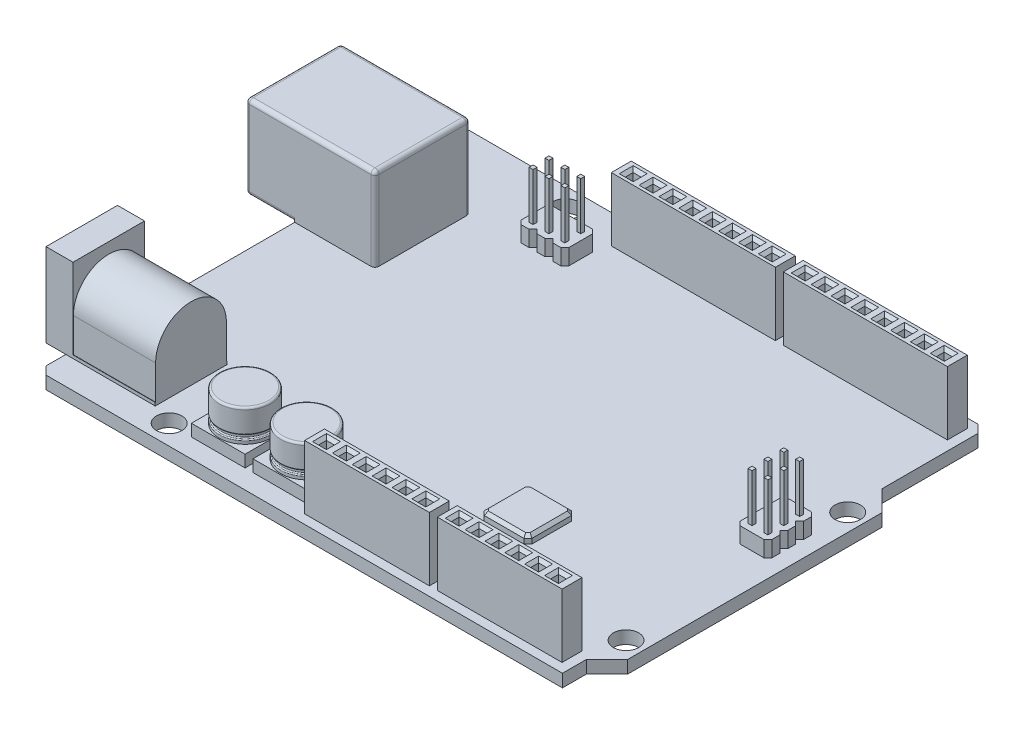
from build123d import *

# Parameters (mm, degrees)
SKETCH1_R           = 1.6
BOSS_EXTRUDE1_DEPTH = 1.6
SKETCH2_W           = 16.3
SKETCH2_H           = 12
SKETCH2_W_2         = 13.75
SKETCH2_H_2         = 9
BOSS_EXTRUDE2_DEPTH = 10.5
SKETCH4_W           = 5.376043544
SKETCH4_H           = 2.5
CUT_EXTRUDE1_DEPTH  = 10
FILLET1_R           = 0.5
SKETCH5_R           = 3.5
SKETCH5_R_2         = 0.5
CUT_EXTRUDE2_DEPTH  = 10
CUT_EXTRUDE3_DEPTH  = 10.35
FILLET2_R           = 0.5
SKETCH7_W           = 20.65
SKETCH7_H           = 2.5
SKETCH7_W_2         = 1
SKETCH7_H_2         = 1
SKETCH7_W_3         = 15.7
BOSS_EXTRUDE3_DEPTH = 8
CHAMFER1_SIZE       = 0.375
SKETCH8_W           = 6.75
SKETCH8_H           = 6.75
BOSS_EXTRUDE4_DEPTH = 1.5
SKETCH9_R           = 3.25
BOSS_EXTRUDE5_DEPTH = 4
FILLET3_R           = 0.25
CUT_EXTRUDE4_START  = -0.5
SKETCH10_R          = 3.25
SKETCH10_R_2        = 3
CUT_EXTRUDE4_DEPTH  = 0.5
FILLET4_R           = 0.125
BOSS_EXTRUDE7_DEPTH = 2
SKETCH12_W          = 0.5
SKETCH12_H          = 0.5
BOSS_EXTRUDE8_DEPTH = 6
BOSS_EXTRUDE9_DEPTH = 1
CHAMFER2_SIZE       = 0.375


with BuildPart() as part:
    # Sketch1 → Boss-Extrude1 (new body)
    with BuildSketch(Plane(origin=(0, 0, 0), x_dir=(1, 0, 0), z_dir=(0, 1, 0))):
        Polygon((35.6, 10.95), (35.6, -21.05), (33, -23.65), (33, -26.65), (-32, -26.65), (-33, -25.65), (-33, 25.65), (-32, 26.65), (32, 26.65), (33, 25.65), (33, 13.55), align=None)
        with Locations(Location((-17.4, 24.15, 0), (0, 0, 270))):
            Circle(SKETCH1_R, mode=Mode.SUBTRACT)
        with Locations(Location((-19, -24.15, 0), (0, 0, 270))):
            Circle(SKETCH1_R, mode=Mode.SUBTRACT)
        with Locations(Location((33.4, -19.05, 0), (0, 0, 270))):
            Circle(SKETCH1_R, mode=Mode.SUBTRACT)
        with Locations(Location((33.4, 8.85, 0), (0, 0, 270))):
            Circle(SKETCH1_R, mode=Mode.SUBTRACT)
    extrude(amount=BOSS_EXTRUDE1_DEPTH)

    # Sketch2 → Boss-Extrude2 (add)
    with BuildSketch(Plane(origin=(0, 1.6, 0), x_dir=(1, 0, 0), z_dir=(0, 1, 0))):
        with Locations((-31.05, 11.65)):
            Rectangle(SKETCH2_W, SKETCH2_H)
        with Locations((-28.625, -18.65)):
            Rectangle(SKETCH2_W_2, SKETCH2_H_2)
    extrude(amount=BOSS_EXTRUDE2_DEPTH)

    # Sketch4 → Cut-Extrude1 (cut)
    with BuildSketch(Plane.ZY.offset(39.2)):
        Polygon((-7.15, 3.1), (-16.15, 3.1), (-16.15, 8.105420966), (-14.338021772, 10.6), (-8.961978228, 10.6), (-7.15, 8.105420966), align=None)
        with Locations((-11.65, 6.855420966)):
            Rectangle(SKETCH4_W, SKETCH4_H, mode=Mode.SUBTRACT)
    extrude(amount=-CUT_EXTRUDE1_DEPTH, mode=Mode.SUBTRACT)

    # Fillet1
    fillet1_edges = [part.edges().sort_by_distance(p)[0] for p in [
        (-39.2, 12.1, -11.65),
        (-39.2, 1.6, -11.65),
        (-36.1, 1.6, -17.65),
        (-36.1, 1.6, -5.65),
        (-39.2, 6.85, -17.65),
        (-39.2, 6.85, -5.65),
        (-22.9, 6.85, -17.65),
        (-22.9, 6.85, -5.65),
        (-22.9, 12.1, -11.65),
        (-31.05, 12.1, -17.65),
        (-31.05, 12.1, -5.65),
    ]]
    fillet(fillet1_edges, radius=FILLET1_R)

    # Sketch5 → Cut-Extrude2 (cut)
    with BuildSketch(Plane.ZY.offset(35.5)):
        with Locations((18.65, 6.85)):
            Circle(SKETCH5_R)
        with Locations((18.65, 6.85)):
            Circle(SKETCH5_R_2, mode=Mode.SUBTRACT)
    extrude(amount=-CUT_EXTRUDE2_DEPTH, mode=Mode.SUBTRACT)

    # Sketch6 → Cut-Extrude3 (cut)
    with BuildSketch(Plane(origin=(-21.75, 0, 0), x_dir=(0, 0, -1), z_dir=(1, 0, 0))):
        with BuildLine():
            Line((-23.105926405, 6.272920857), (-23.105926405, 1.999528991))
            Line((-23.105926405, 1.999528991), (-23.15, 1.999528991))
            Line((-23.15, 1.999528991), (-23.15, 12.1))
            Line((-23.15, 12.1), (-14.15, 12.1))
            Line((-14.15, 12.1), (-14.15, 1.999528991))
            Line((-14.15, 1.999528991), (-14.194073595, 1.999528991))
            Line((-14.194073595, 1.999528991), (-14.194073595, 6.272920857))
            ThreePointArc((-14.194073595, 6.272920857), (-18.65, 10.728847263), (-23.105926405, 6.272920857))
        make_face()
    extrude(amount=-CUT_EXTRUDE3_DEPTH, mode=Mode.SUBTRACT)

    # Fillet2
    fillet2_edges = [part.edges().sort_by_distance(p)[0] for p in [
        (-35.5, 6.85, 18.15),
    ]]
    fillet(fillet2_edges, radius=FILLET2_R)

    # Sketch7 → Boss-Extrude3 (add)
    # profile 1 of 4: a face of its own
    with BuildSketch(Plane(origin=(0, 1.6, 0), x_dir=(1, 0, 0), z_dir=(0, 1, 0))):
        with Locations((-0.175152298, 24.25)):
            Rectangle(SKETCH7_W, SKETCH7_H)
        with Locations((-9.000152298, 24.25)):
            Rectangle(SKETCH7_W_2, SKETCH7_H_2, mode=Mode.SUBTRACT)
        with Locations((-6.500152298, 24.25)):
            Rectangle(SKETCH7_W_2, SKETCH7_H_2, mode=Mode.SUBTRACT)
        with Locations((-4.000152298, 24.25)):
            Rectangle(SKETCH7_W_2, SKETCH7_H_2, mode=Mode.SUBTRACT)
        with Locations((-1.500152298, 24.25)):
            Rectangle(SKETCH7_W_2, SKETCH7_H_2, mode=Mode.SUBTRACT)
        with Locations((0.999847702, 24.25)):
            Rectangle(SKETCH7_W_2, SKETCH7_H_2, mode=Mode.SUBTRACT)
        with Locations((3.499847702, 24.25)):
            Rectangle(SKETCH7_W_2, SKETCH7_H_2, mode=Mode.SUBTRACT)
        with Locations((5.999847702, 24.25)):
            Rectangle(SKETCH7_W_2, SKETCH7_H_2, mode=Mode.SUBTRACT)
        with Locations((8.499847702, 24.25)):
            Rectangle(SKETCH7_W_2, SKETCH7_H_2, mode=Mode.SUBTRACT)
    # profile 2 of 4: a face of its own
    with BuildSketch(Plane(origin=(0, 1.6, 0), x_dir=(1, 0, 0), z_dir=(0, 1, 0))):
        with Locations((21.474847702, 24.25)):
            Rectangle(SKETCH7_W, SKETCH7_H)
        with Locations((12.649847702, 24.25)):
            Rectangle(SKETCH7_W_2, SKETCH7_H_2, mode=Mode.SUBTRACT)
        with Locations((15.149847702, 24.25)):
            Rectangle(SKETCH7_W_2, SKETCH7_H_2, mode=Mode.SUBTRACT)
        with Locations((17.649847702, 24.25)):
            Rectangle(SKETCH7_W_2, SKETCH7_H_2, mode=Mode.SUBTRACT)
        with Locations((20.149847702, 24.25)):
            Rectangle(SKETCH7_W_2, SKETCH7_H_2, mode=Mode.SUBTRACT)
        with Locations((22.649847702, 24.25)):
            Rectangle(SKETCH7_W_2, SKETCH7_H_2, mode=Mode.SUBTRACT)
        with Locations((25.149847702, 24.25)):
            Rectangle(SKETCH7_W_2, SKETCH7_H_2, mode=Mode.SUBTRACT)
        with Locations((27.649847702, 24.25)):
            Rectangle(SKETCH7_W_2, SKETCH7_H_2, mode=Mode.SUBTRACT)
        with Locations((30.149847702, 24.25)):
            Rectangle(SKETCH7_W_2, SKETCH7_H_2, mode=Mode.SUBTRACT)
    # profile 3 of 4: a face of its own
    with BuildSketch(Plane(origin=(0, 1.6, 0), x_dir=(1, 0, 0), z_dir=(0, 1, 0))):
        with Locations((23.949847702, -24.25)):
            Rectangle(SKETCH7_W_3, SKETCH7_H)
        with Locations((17.599847702, -24.25)):
            Rectangle(SKETCH7_W_2, SKETCH7_H_2, mode=Mode.SUBTRACT)
        with Locations((20.099847702, -24.25)):
            Rectangle(SKETCH7_W_2, SKETCH7_H_2, mode=Mode.SUBTRACT)
        with Locations((22.599847702, -24.25)):
            Rectangle(SKETCH7_W_2, SKETCH7_H_2, mode=Mode.SUBTRACT)
        with Locations((25.099847702, -24.25)):
            Rectangle(SKETCH7_W_2, SKETCH7_H_2, mode=Mode.SUBTRACT)
        with Locations((27.599847702, -24.25)):
            Rectangle(SKETCH7_W_2, SKETCH7_H_2, mode=Mode.SUBTRACT)
        with Locations((30.099847702, -24.25)):
            Rectangle(SKETCH7_W_2, SKETCH7_H_2, mode=Mode.SUBTRACT)
    # profile 4 of 4: a face of its own
    with BuildSketch(Plane(origin=(0, 1.6, 0), x_dir=(1, 0, 0), z_dir=(0, 1, 0))):
        with Locations((7.249847702, -24.25)):
            Rectangle(SKETCH7_W_3, SKETCH7_H)
        with Locations((3.399847702, -24.25)):
            Rectangle(SKETCH7_W_2, SKETCH7_H_2, mode=Mode.SUBTRACT)
        with Locations((0.899847702, -24.25)):
            Rectangle(SKETCH7_W_2, SKETCH7_H_2, mode=Mode.SUBTRACT)
        with Locations((5.899847702, -24.25)):
            Rectangle(SKETCH7_W_2, SKETCH7_H_2, mode=Mode.SUBTRACT)
        with Locations((8.399847702, -24.25)):
            Rectangle(SKETCH7_W_2, SKETCH7_H_2, mode=Mode.SUBTRACT)
        with Locations((10.899847702, -24.25)):
            Rectangle(SKETCH7_W_2, SKETCH7_H_2, mode=Mode.SUBTRACT)
        with Locations((13.399847702, -24.25)):
            Rectangle(SKETCH7_W_2, SKETCH7_H_2, mode=Mode.SUBTRACT)
    extrude(amount=BOSS_EXTRUDE3_DEPTH)

    # Chamfer1
    chamfer1_edges = [part.edges().sort_by_distance(p)[0] for p in [
        (-9.500152298, 9.6, -24.25),
        (-9.000152298, 9.6, -23.75),
        (-8.500152298, 9.6, -24.25),
        (-9.000152298, 9.6, -24.75),
        (-7.000152298, 9.6, -24.25),
        (-6.500152298, 9.6, -23.75),
        (-6.000152298, 9.6, -24.25),
        (-6.500152298, 9.6, -24.75),
        (-4.500152298, 9.6, -24.25),
        (-4.000152298, 9.6, -23.75),
        (-3.500152298, 9.6, -24.25),
        (-4.000152298, 9.6, -24.75),
        (-2.000152298, 9.6, -24.25),
        (-1.500152298, 9.6, -23.75),
        (-1.000152298, 9.6, -24.25),
        (-1.500152298, 9.6, -24.75),
        (0.499847702, 9.6, -24.25),
        (0.999847702, 9.6, -23.75),
        (1.499847702, 9.6, -24.25),
        (0.999847702, 9.6, -24.75),
        (2.999847702, 9.6, -24.25),
        (3.499847702, 9.6, -23.75),
        (3.999847702, 9.6, -24.25),
        (3.499847702, 9.6, -24.75),
        (5.499847702, 9.6, -24.25),
        (5.999847702, 9.6, -23.75),
        (6.499847702, 9.6, -24.25),
        (5.999847702, 9.6, -24.75),
        (7.999847702, 9.6, -24.25),
        (8.499847702, 9.6, -23.75),
        (8.999847702, 9.6, -24.25),
        (8.499847702, 9.6, -24.75),
        (12.149847702, 9.6, -24.25),
        (12.649847702, 9.6, -23.75),
        (13.149847702, 9.6, -24.25),
        (12.649847702, 9.6, -24.75),
        (14.649847702, 9.6, -24.25),
        (15.149847702, 9.6, -23.75),
        (15.649847702, 9.6, -24.25),
        (15.149847702, 9.6, -24.75),
        (17.149847702, 9.6, -24.25),
        (17.649847702, 9.6, -23.75),
        (18.149847702, 9.6, -24.25),
        (17.649847702, 9.6, -24.75),
        (19.649847702, 9.6, -24.25),
        (20.149847702, 9.6, -23.75),
        (20.649847702, 9.6, -24.25),
        (20.149847702, 9.6, -24.75),
        (22.149847702, 9.6, -24.25),
        (22.649847702, 9.6, -23.75),
        (23.149847702, 9.6, -24.25),
        (22.649847702, 9.6, -24.75),
        (24.649847702, 9.6, -24.25),
        (25.149847702, 9.6, -23.75),
        (25.649847702, 9.6, -24.25),
        (25.149847702, 9.6, -24.75),
        (27.149847702, 9.6, -24.25),
        (27.649847702, 9.6, -23.75),
        (28.149847702, 9.6, -24.25),
        (27.649847702, 9.6, -24.75),
        (29.649847702, 9.6, -24.25),
        (30.149847702, 9.6, -23.75),
        (30.649847702, 9.6, -24.25),
        (30.149847702, 9.6, -24.75),
        (17.099847702, 9.6, 24.25),
        (17.599847702, 9.6, 24.75),
        (18.099847702, 9.6, 24.25),
        (17.599847702, 9.6, 23.75),
        (19.599847702, 9.6, 24.25),
        (20.099847702, 9.6, 24.75),
        (20.599847702, 9.6, 24.25),
        (20.099847702, 9.6, 23.75),
        (22.099847702, 9.6, 24.25),
        (22.599847702, 9.6, 24.75),
        (23.099847702, 9.6, 24.25),
        (22.599847702, 9.6, 23.75),
        (24.599847702, 9.6, 24.25),
        (25.099847702, 9.6, 24.75),
        (25.599847702, 9.6, 24.25),
        (25.099847702, 9.6, 23.75),
        (27.099847702, 9.6, 24.25),
        (27.599847702, 9.6, 24.75),
        (28.099847702, 9.6, 24.25),
        (27.599847702, 9.6, 23.75),
        (29.599847702, 9.6, 24.25),
        (30.099847702, 9.6, 24.75),
        (30.599847702, 9.6, 24.25),
        (30.099847702, 9.6, 23.75),
        (0.399847702, 9.6, 24.25),
        (0.899847702, 9.6, 24.75),
        (1.399847702, 9.6, 24.25),
        (0.899847702, 9.6, 23.75),
        (2.899847702, 9.6, 24.25),
        (3.399847702, 9.6, 24.75),
        (3.899847702, 9.6, 24.25),
        (3.399847702, 9.6, 23.75),
        (5.399847702, 9.6, 24.25),
        (5.899847702, 9.6, 24.75),
        (6.399847702, 9.6, 24.25),
        (5.899847702, 9.6, 23.75),
        (7.899847702, 9.6, 24.25),
        (8.399847702, 9.6, 24.75),
        (8.899847702, 9.6, 24.25),
        (8.399847702, 9.6, 23.75),
        (10.399847702, 9.6, 24.25),
        (10.899847702, 9.6, 24.75),
        (11.399847702, 9.6, 24.25),
        (10.899847702, 9.6, 23.75),
        (12.899847702, 9.6, 24.25),
        (13.399847702, 9.6, 24.75),
        (13.899847702, 9.6, 24.25),
        (13.399847702, 9.6, 23.75),
    ]]
    chamfer(chamfer1_edges, length=CHAMFER1_SIZE)

    # Sketch8 → Boss-Extrude4 (add)
    with BuildSketch(Plane(origin=(0, 1.6, 0), x_dir=(1, 0, 0), z_dir=(0, 1, 0))):
        with Locations((-4.975152298, -20.875)):
            Rectangle(SKETCH8_W, SKETCH8_H)
        with Locations((-12.725152298, -20.875)):
            Rectangle(SKETCH8_W, SKETCH8_H)
    extrude(amount=BOSS_EXTRUDE4_DEPTH)

    # Sketch9 → Boss-Extrude5 (add)
    with BuildSketch(Plane(origin=(0, 3.1, 0), x_dir=(1, 0, 0), z_dir=(0, 1, 0))):
        with Locations(Location((-4.975152298, -20.875, 0), (0, 0, 270))):
            Circle(SKETCH9_R)
        with Locations(Location((-12.725152298, -20.875, 0), (0, 0, 270))):
            Circle(SKETCH9_R)
    extrude(amount=BOSS_EXTRUDE5_DEPTH)

    # Fillet3
    fillet3_edges = [part.edges().sort_by_distance(p)[0] for p in [
        (-4.975152298, 7.1, 17.625),
        (-12.725152298, 7.1, 17.625),
    ]]
    fillet(fillet3_edges, radius=FILLET3_R)

    # Sketch10 → Cut-Extrude4 (cut)
    # profile 1 of 2: a face of its own
    with BuildSketch(Plane(origin=(0, 4.1, 0), x_dir=(-1, 0, 0), z_dir=(0, 1, 0)).offset(CUT_EXTRUDE4_START)):
        with Locations(Location((4.975152298, 20.875, 0), (0, 0, 90))):
            Circle(SKETCH10_R)
        with Locations(Location((4.975152298, 20.875, 0), (0, 0, 90))):
            Circle(SKETCH10_R_2, mode=Mode.SUBTRACT)
    # profile 2 of 2: a face of its own
    with BuildSketch(Plane(origin=(0, 4.1, 0), x_dir=(-1, 0, 0), z_dir=(0, 1, 0)).offset(CUT_EXTRUDE4_START)):
        with Locations(Location((12.725152298, 20.875, 0), (0, 0, 90))):
            Circle(SKETCH10_R)
        with Locations(Location((12.725152298, 20.875, 0), (0, 0, 90))):
            Circle(SKETCH10_R_2, mode=Mode.SUBTRACT)
    extrude(amount=CUT_EXTRUDE4_DEPTH, mode=Mode.SUBTRACT)

    # Fillet4
    fillet4_edges = [part.edges().sort_by_distance(p)[0] for p in [
        (-4.975152298, 3.6, 17.625),
        (-4.975152298, 3.6, 17.875),
        (-4.975152298, 4.1, 17.625),
        (-4.975152298, 4.1, 17.875),
        (-12.725152298, 3.6, 17.625),
        (-12.725152298, 3.6, 17.875),
        (-12.725152298, 4.1, 17.625),
        (-12.725152298, 4.1, 17.875),
    ]]
    fillet(fillet4_edges, radius=FILLET4_R - 0.0001)  # a hair under: the kernel refuses the full size

    # Sketch11 → Boss-Extrude7 (add)
    with BuildSketch(Plane(origin=(0, 1.6, 0), x_dir=(1, 0, 0), z_dir=(0, 1, 0))):
        Polygon((-16.5, 21.65), (-17, 21.15), (-17, 18.15), (-16.5, 17.65), (-15.5, 17.65), (-15, 18.15), (-14.5, 17.65), (-13.5, 17.65), (-13, 18.15), (-12.5, 17.65), (-11.5, 17.65), (-11, 18.15), (-11, 21.15), (-11.5, 21.65), (-12.5, 21.65), (-13, 21.15), (-13.5, 21.65), (-14.5, 21.65), (-15, 21.15), (-15.5, 21.65), align=None)
        Polygon((30.1, 4.606591107), (29.6, 4.106591107), (29.6, 3.106591107), (30.1, 2.606591107), (29.6, 2.106591107), (29.6, 1.106591107), (30.1, 0.606591107), (29.6, 0.106591107), (29.6, -0.893408893), (30.1, -1.393408893), (33.1, -1.393408893), (33.6, -0.893408893), (33.6, 0.106591107), (33.1, 0.606591107), (33.6, 1.106591107), (33.6, 2.106591107), (33.1, 2.606591107), (33.6, 3.106591107), (33.6, 4.106591107), (33.1, 4.606591107), align=None)
    extrude(amount=BOSS_EXTRUDE7_DEPTH)

    # Sketch12 → Boss-Extrude8 (add)
    with BuildSketch(Plane(origin=(0, 3.6, 0), x_dir=(1, 0, 0), z_dir=(0, 1, 0))):
        with Locations((-16, 20.65)):
            Rectangle(SKETCH12_W, SKETCH12_H)
        with Locations((-16, 18.65)):
            Rectangle(SKETCH12_W, SKETCH12_H)
        with Locations((-14, 20.65)):
            Rectangle(SKETCH12_W, SKETCH12_H)
        with Locations((-14, 18.65)):
            Rectangle(SKETCH12_W, SKETCH12_H)
        with Locations((-12, 20.65)):
            Rectangle(SKETCH12_W, SKETCH12_H)
        with Locations((-12, 18.65)):
            Rectangle(SKETCH12_W, SKETCH12_H)
        with Locations((32.6, 3.606591107)):
            Rectangle(SKETCH12_W, SKETCH12_H)
        with Locations((30.6, 3.606591107)):
            Rectangle(SKETCH12_W, SKETCH12_H)
        with Locations((32.6, 1.606591107)):
            Rectangle(SKETCH12_W, SKETCH12_H)
        with Locations((30.6, 1.606591107)):
            Rectangle(SKETCH12_W, SKETCH12_H)
        with Locations((32.6, -0.393408893)):
            Rectangle(SKETCH12_W, SKETCH12_H)
        with Locations((30.6, -0.393408893)):
            Rectangle(SKETCH12_W, SKETCH12_H)
    extrude(amount=BOSS_EXTRUDE8_DEPTH)

    # Sketch13 → Boss-Extrude9 (add)
    with BuildSketch(Plane(origin=(0, 1.6, 0), x_dir=(1, 0, 0), z_dir=(0, 1, 0))):
        Polygon((17, -9.5), (16.5, -9), (11.5, -9), (11, -9.5), (11, -14.5), (11.5, -15), (16.5, -15), (17, -14.5), align=None)
    extrude(amount=BOSS_EXTRUDE9_DEPTH)

    # Chamfer2
    chamfer2_edges = [part.edges().sort_by_distance(p)[0] for p in [
        (14, 2.6, 9),
        (11.25, 2.6, 9.25),
        (11, 2.6, 12),
        (11.25, 2.6, 14.75),
        (14, 2.6, 15),
        (16.75, 2.6, 14.75),
        (17, 2.6, 12),
        (16.75, 2.6, 9.25),
    ]]
    chamfer(chamfer2_edges, length=CHAMFER2_SIZE)


solid = part.part
